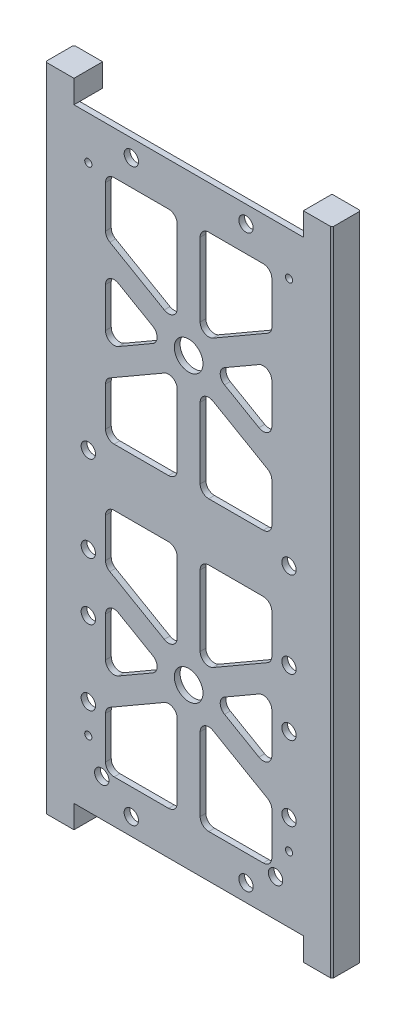
from build123d import *

# Parameters (mm, degrees)
SKETCH1_W                   = 88
SKETCH1_H                   = 211
BOSS_EXTRUDE1_DEPTH         = 2
CUT_EXTRUDE2_DEPTH          = 2
SKETCH4_R                   = 5
CUT_EXTRUDE3_DEPTH          = 229.624145706
FILLET2_R                   = 3
BOSS_EXTRUDE2_DEPTH         = 10
CUT_EXTRUDE5_DEPTH          = 8
SKETCH58_R                  = 1.665
CUT_EXTRUDE9_DEPTH          = 1.8
SKETCH59_R                  = 2
CUT_EXTRUDE10_DEPTH         = 10
FILLET3_SIZE                = 0.5
F_5_0MM_DOWEL_HOLE1_D       = 5
TAP_DRILL_FOR_M3X0_5_TAP1_D = 2.5


with BuildPart() as part:
    # Sketch1 → Boss-Extrude1 (new body)
    with BuildSketch(Plane.XY):
        with Locations((44, 105.5)):
            Rectangle(SKETCH1_W, SKETCH1_H)
    extrude(amount=BOSS_EXTRUDE1_DEPTH)

    # Sketch3 → Cut-Extrude2 (cut)
    with BuildSketch(Plane.XY.offset(2)):
        Polygon((40, 196), (15, 196), (15, 176.61195996), (40, 162.17820323), align=None)
        Polygon((73, 196), (48, 196), (48, 162.17820323), (73, 176.61195996), align=None)
        Polygon((36, 155.25), (15, 167.374355653), (15, 143.125644347), align=None)
        Polygon((40, 148.32179677), (15, 133.88804004), (15, 115.5), (40, 115.5), align=None)
        Polygon((73, 143.125644347), (73, 167.374355653), (52, 155.25), align=None)
        Polygon((73, 115.5), (73, 133.88804004), (48, 148.32179677), (48, 115.5), align=None)
    cut_extrude2 = extrude(amount=-CUT_EXTRUDE2_DEPTH, mode=Mode.SUBTRACT)

    # Sketch4 → Cut-Extrude3 (cut, through all)
    with BuildSketch(Plane.XY.offset(2)):
        with Locations((44, 155.25)):
            Circle(SKETCH4_R)
    cut_extrude3 = extrude(amount=-CUT_EXTRUDE3_DEPTH, mode=Mode.SUBTRACT)

    # Mirror2: Cut-Extrude2, Cut-Extrude3 across plane
    add(cut_extrude2.mirror(Plane(origin=(0, 105.5, 0), x_dir=(0, 0, 1), z_dir=(0, -1, 0))), mode=Mode.SUBTRACT)
    add(cut_extrude3.mirror(Plane(origin=(0, 105.5, 0), x_dir=(0, 0, 1), z_dir=(0, -1, 0))), mode=Mode.SUBTRACT)

    # Fillet2
    fillet2_edges = [part.edges().sort_by_distance(p)[0] for p in [
        (73, 67.874355653, 1),
        (73, 43.625644347, 1),
        (52, 55.75, 1),
        (40, 48.82179677, 1),
        (40, 15, 1),
        (15, 15, 1),
        (15, 34.38804004, 1),
        (15, 143.125644347, 1),
        (15, 167.374355653, 1),
        (36, 155.25, 1),
        (15, 115.5, 1),
        (15, 133.88804004, 1),
        (40, 148.32179677, 1),
        (40, 115.5, 1),
        (48, 196, 1),
        (73, 196, 1),
        (48, 162.17820323, 1),
        (73, 115.5, 1),
        (48, 115.5, 1),
        (48, 148.32179677, 1),
        (73, 133.88804004, 1),
        (15, 196, 1),
        (40, 196, 1),
        (40, 162.17820323, 1),
        (15, 176.61195996, 1),
        (73, 167.374355653, 1),
        (73, 143.125644347, 1),
        (52, 155.25, 1),
        (48, 62.67820323, 1),
        (48, 95.5, 1),
        (73, 95.5, 1),
        (73, 77.11195996, 1),
        (73, 34.38804004, 1),
        (73, 15, 1),
        (48, 15, 1),
        (48, 48.82179677, 1),
        (40, 62.67820323, 1),
        (15, 77.11195996, 1),
        (15, 95.5, 1),
        (40, 95.5, 1),
        (15, 43.625644347, 1),
        (15, 67.874355653, 1),
        (36, 55.75, 1),
        (73, 176.61195996, 1),
    ]]
    fillet(fillet2_edges, radius=FILLET2_R)

    # Sketch7 → Boss-Extrude2 (add)
    with BuildSketch(Plane.XY.offset(2)):
        Polygon((94, 219), (84, 219), (84, 211), (88, 211), (88, 0), (84, 0), (84, -8), (94, -8), align=None)
        Polygon((-6, -8), (4, -8), (4, 0), (0, 0), (0, 211), (4, 211), (4, 219), (-6, 219), align=None)
    extrude(amount=-BOSS_EXTRUDE2_DEPTH)

    # Sketch53 → Cut-Extrude5 (cut)
    with BuildSketch(Plane(origin=(0, 0, -8), x_dir=(-1, 0, 0), z_dir=(0, 0, -1))):
        with BuildLine():
            Line((-90, 0), (-88, 0))
            Line((-88, 0), (-88, 211))
            Line((-88, 211), (-90, 211))
            ThreePointArc((-90, 211), (-91.414213562, 210.414213562), (-92, 209))
            Line((-92, 209), (-92, 2))
            ThreePointArc((-92, 2), (-91.414213562, 0.585786438), (-90, 0))
        make_face()
        with BuildLine():
            Line((4, 2), (4, 209))
            ThreePointArc((4, 209), (3.414213562, 210.414213562), (2, 211))
            Line((2, 211), (-4, 211))
            Line((-4, 211), (-4, 0))
            Line((-4, 0), (2, 0))
            ThreePointArc((2, 0), (3.414213562, 0.585786438), (4, 2))
        make_face()
    extrude(amount=-CUT_EXTRUDE5_DEPTH, mode=Mode.SUBTRACT)

    # Sketch58 → Cut-Extrude9 (cut)
    with BuildSketch(Plane(origin=(0, 0, 0), x_dir=(-1, 0, 0), z_dir=(0, 0, -1))):
        with Locations((-0.7, 13)):
            Circle(SKETCH58_R)
    cut_extrude9 = extrude(amount=-CUT_EXTRUDE9_DEPTH, mode=Mode.SUBTRACT)

    # Mirror4: Cut-Extrude9 across plane
    add(cut_extrude9.mirror(Plane(origin=(44, 0, 0), x_dir=(0, 0, 1), z_dir=(1, 0, 0))), mode=Mode.SUBTRACT)

    # Sketch59 → Cut-Extrude10 (cut)
    with BuildSketch(Plane(origin=(0, -8, 0), x_dir=(-1, 0, 0), z_dir=(0, -1, 0))):
        with Locations((-89, 2.4)):
            Circle(SKETCH59_R)
        with Locations((1, 2.4)):
            Circle(SKETCH59_R)
    extrude(amount=-CUT_EXTRUDE10_DEPTH, mode=Mode.SUBTRACT)

    # Fillet3
    fillet3_edges = [part.edges().sort_by_distance(p)[0] for p in [
        (-6, 105.5, 2),
        (-6, 105.5, -8),
        (94, 105.5, -8),
        (94, 105.5, 2),
    ]]
    chamfer(fillet3_edges, length=FILLET3_SIZE)

    # Ø5.0mm Dowel Hole1 (through all)
    with Locations(Plane.XY.offset(2)):
        with Locations((24, 205), (64, 205), (9, 109.2), (79, 109.2), (9, 79.2), (79, 79.2), (9, 59.2), (79, 59.2), (9, 33.2), (79, 33.2), (13.7, 13), (24, 6), (74.3, 13), (64, 6)):
            Hole(F_5_0MM_DOWEL_HOLE1_D / 2)

    # Tap Drill for M3x0.5 Tap1 (through all)
    with Locations(Plane.XY.offset(2)):
        with Locations((9, 196), (79, 196), (9, 23), (79, 23)):
            Hole(TAP_DRILL_FOR_M3X0_5_TAP1_D / 2)


solid = part.part
